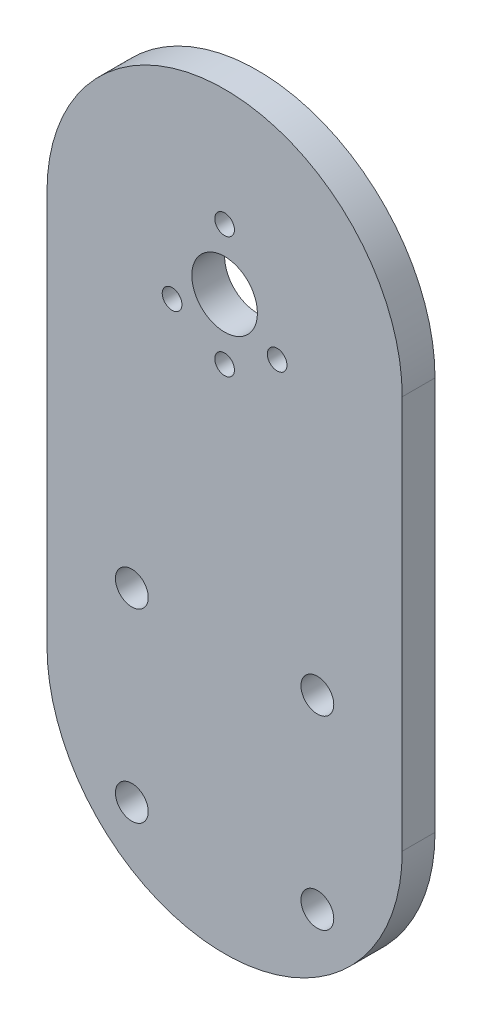
from build123d import *

# Parameters (mm, degrees)
BOSS_EXTRUDE1_DEPTH = 5
SKETCH2_R           = 2.5
CUT_EXTRUDE1_DEPTH  = 5
SKETCH3_R           = 5
CUT_EXTRUDE2_DEPTH  = 5
SKETCH4_R           = 1.5
CUT_EXTRUDE3_DEPTH  = 5


with BuildPart() as part:
    # Sketch1 → Boss-Extrude1 (new body)
    with BuildSketch(Plane.XY):
        with BuildLine():
            Line((-27.08, 0), (-27.08, 60))
            ThreePointArc((-27.08, 60), (0, 87.08), (27.08, 60))
            Line((27.08, 60), (27.08, 0))
            ThreePointArc((27.08, 0), (0, -27.08), (-27.08, 0))
        make_face()
    extrude(amount=BOSS_EXTRUDE1_DEPTH)

    # Sketch2 → Cut-Extrude1 (cut)
    with BuildSketch(Plane.XY.offset(5)):
        with Locations((14.142135624, 14.142135624)):
            Circle(SKETCH2_R)
        with Locations((14.142135624, -14.142135624)):
            Circle(SKETCH2_R)
        with Locations((-14.142135624, -14.142135624)):
            Circle(SKETCH2_R)
        with Locations((-14.142135624, 14.142135624)):
            Circle(SKETCH2_R)
    extrude(amount=-CUT_EXTRUDE1_DEPTH, mode=Mode.SUBTRACT)

    # Sketch3 → Cut-Extrude2 (cut)
    with BuildSketch(Plane.XY.offset(5)):
        with Locations((0, 60)):
            Circle(SKETCH3_R)
    extrude(amount=-CUT_EXTRUDE2_DEPTH, mode=Mode.SUBTRACT)

    # Sketch4 → Cut-Extrude3 (cut)
    with BuildSketch(Plane.XY.offset(5)):
        with Locations((0, 69.25)):
            Circle(SKETCH4_R)
        with Locations((0, 50.75)):
            Circle(SKETCH4_R)
        with Locations((8.010734985, 55.375)):
            Circle(SKETCH4_R)
        with Locations((-8.010734985, 55.375)):
            Circle(SKETCH4_R)
    extrude(amount=-CUT_EXTRUDE3_DEPTH, mode=Mode.SUBTRACT)


solid = part.part
